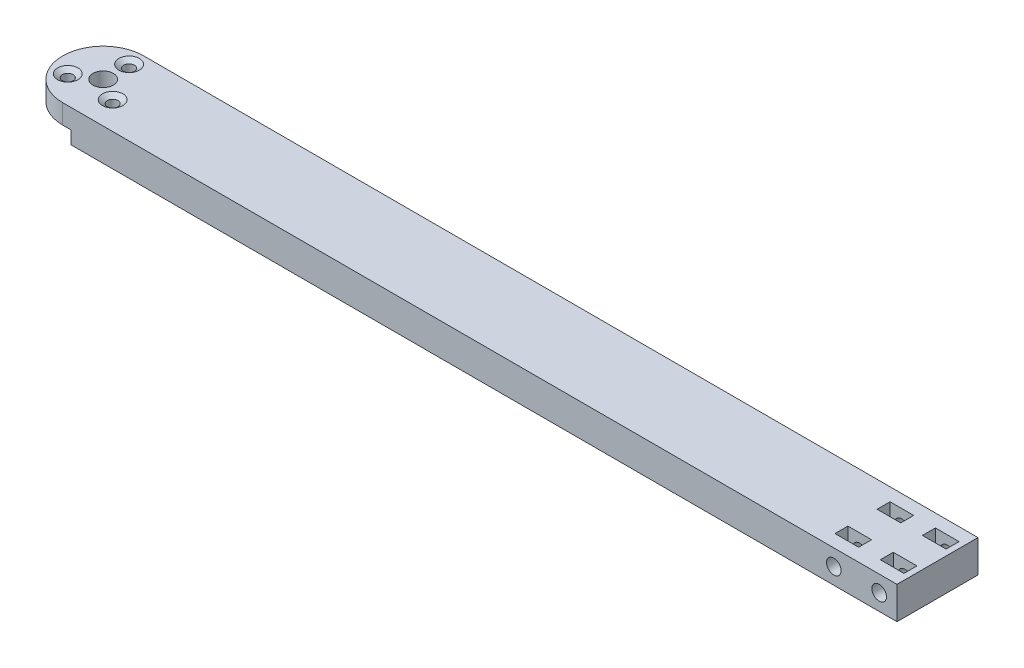
from build123d import *

# Parameters (mm, degrees)
SKETCH1_W           = 270
SKETCH1_H           = 25
BOSS_EXTRUDE1_DEPTH = 10
CUT_EXTRUDE1_REACH  = 273.339
SKETCH2_R           = 3.15
FILLET1_R           = 12.5
SKETCH3_R           = 2.25
CUT_EXTRUDE2_DEPTH  = 272.339271024
CUT_EXTRUDE5_REACH  = 273.339
SKETCH5_W           = 7.3
SKETCH5_H           = 4
SKETCH6_R           = 12.75
CUT_EXTRUDE6_DEPTH  = 4
CUT_EXTRUDE7_REACH  = 273.221
SKETCH7_R           = 1.65
CHAMFER1_SIZE       = 1.5
CHAMFER1_SIZE2      = 1.050311307


with BuildPart() as part:
    # Sketch1 → Boss-Extrude1 (new body)
    with BuildSketch(Plane(origin=(0, 0, 0), x_dir=(1, 0, 0), z_dir=(0, 1, 0))):
        with Locations((135, 12.5)):
            Rectangle(SKETCH1_W, SKETCH1_H)
    extrude(amount=BOSS_EXTRUDE1_DEPTH)

    # Sketch2 → Cut-Extrude1 (cut, up to next)
    with BuildSketch(Plane(origin=(0, 10, 0), x_dir=(1, 0, 0), z_dir=(0, 1, 0)), mode=Mode.PRIVATE) as cut_extrude1_sk1:
        with Locations(Location((12.5, 12.5, 0), (0, 0, 270))):
            Circle(SKETCH2_R)
    cut_extrude1_tool1 = extrude(cut_extrude1_sk1.sketch, amount=-CUT_EXTRUDE1_REACH, mode=Mode.PRIVATE) & part.part
    add(cut_extrude1_tool1.solids().sort_by_distance((12.5, 10, -12.5))[0], mode=Mode.SUBTRACT)

    # Fillet1
    fillet1_edges = [part.edges().sort_by_distance(p)[0] for p in [
        (0, 5, 0),
        (0, 5, -25),
    ]]
    fillet(fillet1_edges, radius=FILLET1_R - 0.0001)  # a hair under: the kernel refuses the full size

    # Sketch3 → Cut-Extrude2 (cut, through all)
    with BuildSketch(Plane(origin=(0, 0, -25), x_dir=(-1, 0, 0), z_dir=(0, 0, -1))):
        with Locations((-264.5, 5)):
            Circle(SKETCH3_R)
        with Locations((-250.5, 5)):
            Circle(SKETCH3_R)
    extrude(amount=-CUT_EXTRUDE2_DEPTH, mode=Mode.SUBTRACT)

    # Sketch5 → Cut-Extrude5 (cut, up to next)
    with BuildSketch(Plane(origin=(0, 10, 0), x_dir=(1, 0, 0), z_dir=(0, 1, 0)), mode=Mode.PRIVATE) as cut_extrude5_sk1:
        with Locations((264.5, 19)):
            Rectangle(SKETCH5_W, SKETCH5_H)
    cut_extrude5_tool1 = extrude(cut_extrude5_sk1.sketch, amount=-CUT_EXTRUDE5_REACH, mode=Mode.PRIVATE) & part.part
    # Sketch5 → Cut-Extrude5 (cut, up to next)
    with BuildSketch(Plane(origin=(0, 10, 0), x_dir=(1, 0, 0), z_dir=(0, 1, 0)), mode=Mode.PRIVATE) as cut_extrude5_sk2:
        with Locations((264.5, 6)):
            Rectangle(SKETCH5_W, SKETCH5_H)
    cut_extrude5_tool2 = extrude(cut_extrude5_sk2.sketch, amount=-CUT_EXTRUDE5_REACH, mode=Mode.PRIVATE) & part.part
    # Sketch5 → Cut-Extrude5 (cut, up to next)
    with BuildSketch(Plane(origin=(0, 10, 0), x_dir=(1, 0, 0), z_dir=(0, 1, 0)), mode=Mode.PRIVATE) as cut_extrude5_sk3:
        with Locations((250.5, 19)):
            Rectangle(SKETCH5_W, SKETCH5_H)
    cut_extrude5_tool3 = extrude(cut_extrude5_sk3.sketch, amount=-CUT_EXTRUDE5_REACH, mode=Mode.PRIVATE) & part.part
    # Sketch5 → Cut-Extrude5 (cut, up to next)
    with BuildSketch(Plane(origin=(0, 10, 0), x_dir=(1, 0, 0), z_dir=(0, 1, 0)), mode=Mode.PRIVATE) as cut_extrude5_sk4:
        with Locations((250.5, 6)):
            Rectangle(SKETCH5_W, SKETCH5_H)
    cut_extrude5_tool4 = extrude(cut_extrude5_sk4.sketch, amount=-CUT_EXTRUDE5_REACH, mode=Mode.PRIVATE) & part.part
    add(cut_extrude5_tool1.solids().sort_by_distance((264.5, 10, -19))[0], mode=Mode.SUBTRACT)
    add(cut_extrude5_tool2.solids().sort_by_distance((264.5, 10, -6))[0], mode=Mode.SUBTRACT)
    add(cut_extrude5_tool3.solids().sort_by_distance((250.5, 10, -19))[0], mode=Mode.SUBTRACT)
    add(cut_extrude5_tool4.solids().sort_by_distance((250.5, 10, -6))[0], mode=Mode.SUBTRACT)

    # Sketch6 → Cut-Extrude6 (cut)
    with BuildSketch(Plane.XZ):
        with Locations((12.5, -12.5)):
            Circle(SKETCH6_R)
    extrude(amount=-CUT_EXTRUDE6_DEPTH, mode=Mode.SUBTRACT)

    # Sketch7 → Cut-Extrude7 (cut, up to next)
    with BuildSketch(Plane.XZ.offset(-4), mode=Mode.PRIVATE) as cut_extrude7_sk1:
        with Locations(Location((12.5, -20.5, 0), (0, 0, 270))):
            Circle(SKETCH7_R)
    cut_extrude7_tool1 = extrude(cut_extrude7_sk1.sketch, amount=-CUT_EXTRUDE7_REACH, mode=Mode.PRIVATE) & part.part
    # Sketch7 → Cut-Extrude7 (cut, up to next)
    with BuildSketch(Plane.XZ.offset(-4), mode=Mode.PRIVATE) as cut_extrude7_sk2:
        with Locations(Location((5.57179677, -8.5, 0), (0, 0, 270))):
            Circle(SKETCH7_R)
    cut_extrude7_tool2 = extrude(cut_extrude7_sk2.sketch, amount=-CUT_EXTRUDE7_REACH, mode=Mode.PRIVATE) & part.part
    # Sketch7 → Cut-Extrude7 (cut, up to next)
    with BuildSketch(Plane.XZ.offset(-4), mode=Mode.PRIVATE) as cut_extrude7_sk3:
        with Locations(Location((19.42820323, -8.5, 0), (0, 0, 270))):
            Circle(SKETCH7_R)
    cut_extrude7_tool3 = extrude(cut_extrude7_sk3.sketch, amount=-CUT_EXTRUDE7_REACH, mode=Mode.PRIVATE) & part.part
    add(cut_extrude7_tool1.solids().sort_by_distance((12.5, 4, -20.5))[0], mode=Mode.SUBTRACT)
    add(cut_extrude7_tool2.solids().sort_by_distance((5.571797, 4, -8.5))[0], mode=Mode.SUBTRACT)
    add(cut_extrude7_tool3.solids().sort_by_distance((19.428203, 4, -8.5))[0], mode=Mode.SUBTRACT)

    # Chamfer1
    chamfer1_edges = [part.edges().sort_by_distance(p)[0] for p in [
        (12.5, 10, -18.85),
        (5.57179677, 10, -6.85),
        (19.42820323, 10, -6.85),
    ]]
    chamfer1_side = [part.faces().sort_by_distance(p)[0] for p in [
        (135.233508086, 10, -12.5),
    ]]
    chamfer(chamfer1_edges, length=CHAMFER1_SIZE, length2=CHAMFER1_SIZE2, reference=chamfer1_side[0])


solid = part.part
